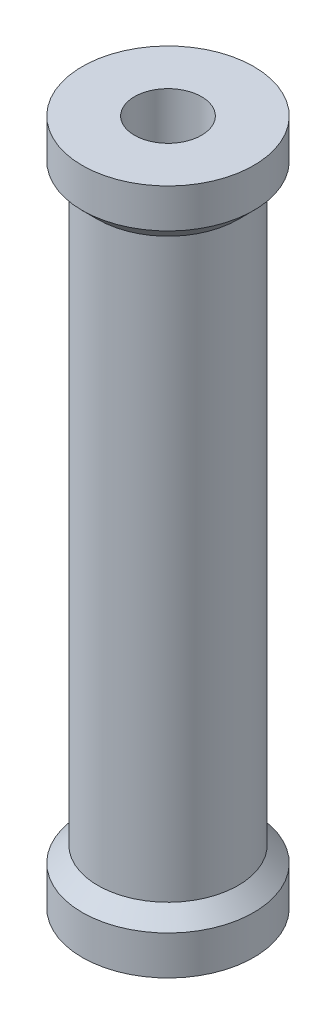
from build123d import *

# Parameters (mm, degrees)
SKETCH_2_R      = 4.5
SKETCH_2_R_2    = 2.15
EXTRUDE_1_DEPTH = 22
EXTRUDE_START   = -2
SKETCH_3_R      = 5.5
SKETCH_3_R_2    = 2.15
EXTRUDE_2_DEPTH = 2
CHAMFER_1_SIZE  = 1.5


with BuildPart() as part:
    # 草图2 → 凸台-拉伸1 (new, symmetric)
    with BuildSketch(Plane(origin=(0, 0, 0), x_dir=(1, 0, 0), z_dir=(0, 1, 0))):
        with Locations(Location((0, 0, 0), (0, 0, 270))):
            Circle(SKETCH_2_R)
        with Locations(Location((0, 0, 0), (0, 0, 270))):
            Circle(SKETCH_2_R_2, mode=Mode.SUBTRACT)
    extrude(amount=EXTRUDE_1_DEPTH, both=True)

    # 草图3 → 凸台-拉伸2 (add)
    with BuildSketch(Plane(origin=(0, 22, 0), x_dir=(1, 0, 0), z_dir=(0, 1, 0)).offset(EXTRUDE_START)):
        with Locations(Location((0, 0, 0), (0, 0, 270))):
            Circle(SKETCH_3_R)
        with Locations(Location((0, 0, 0), (0, 0, 270))):
            Circle(SKETCH_3_R_2, mode=Mode.SUBTRACT)
    extrude_2 = extrude(amount=EXTRUDE_2_DEPTH)

    # 镜向1: 凸台-拉伸2 across plane
    add(extrude_2.mirror(Plane.ZX))

    # 倒角1
    # the kernel refuses this chamfer: 1.5 mm, written as the material it adds along each edge
    with BuildSketch(Plane(origin=(0, -20, 0), x_dir=(0, 0, 1), z_dir=(-1, 0, 0))) as chamfer_1_piece_1_section:
        Polygon((4.5 + CHAMFER_1_SIZE, 0), (4.5, CHAMFER_1_SIZE), (4.5, 0), align=None)
    chamfer_1_piece_1 = revolve(axis=Axis((0, -20, 0), (0, 1, 0)), mode=Mode.PRIVATE)
    chamfer_1_piece_1 = chamfer_1_piece_1 & Plane(origin=(0, -19.001553526, 0), x_dir=(0, 0, 1), z_dir=(0, 1, 0)) * Cylinder(5.5, 24, mode=Mode.PRIVATE)
    add(chamfer_1_piece_1)
    with BuildSketch(Plane(origin=(0, 20, 0), x_dir=(0, 0, 1), z_dir=(-1, 0, 0))) as chamfer_1_piece_2_section:
        Polygon((4.5, -CHAMFER_1_SIZE), (4.5 + CHAMFER_1_SIZE, 0), (4.5, 0), align=None)
    chamfer_1_piece_2 = revolve(axis=Axis((0, 20, 0), (0, 1, 0)), mode=Mode.PRIVATE)
    chamfer_1_piece_2 = chamfer_1_piece_2 & Plane(origin=(0, 19.001553526, 0), x_dir=(0, 0, 1), z_dir=(0, -1, 0)) * Cylinder(5.5, 24, mode=Mode.PRIVATE)
    add(chamfer_1_piece_2)


solid = part.part
